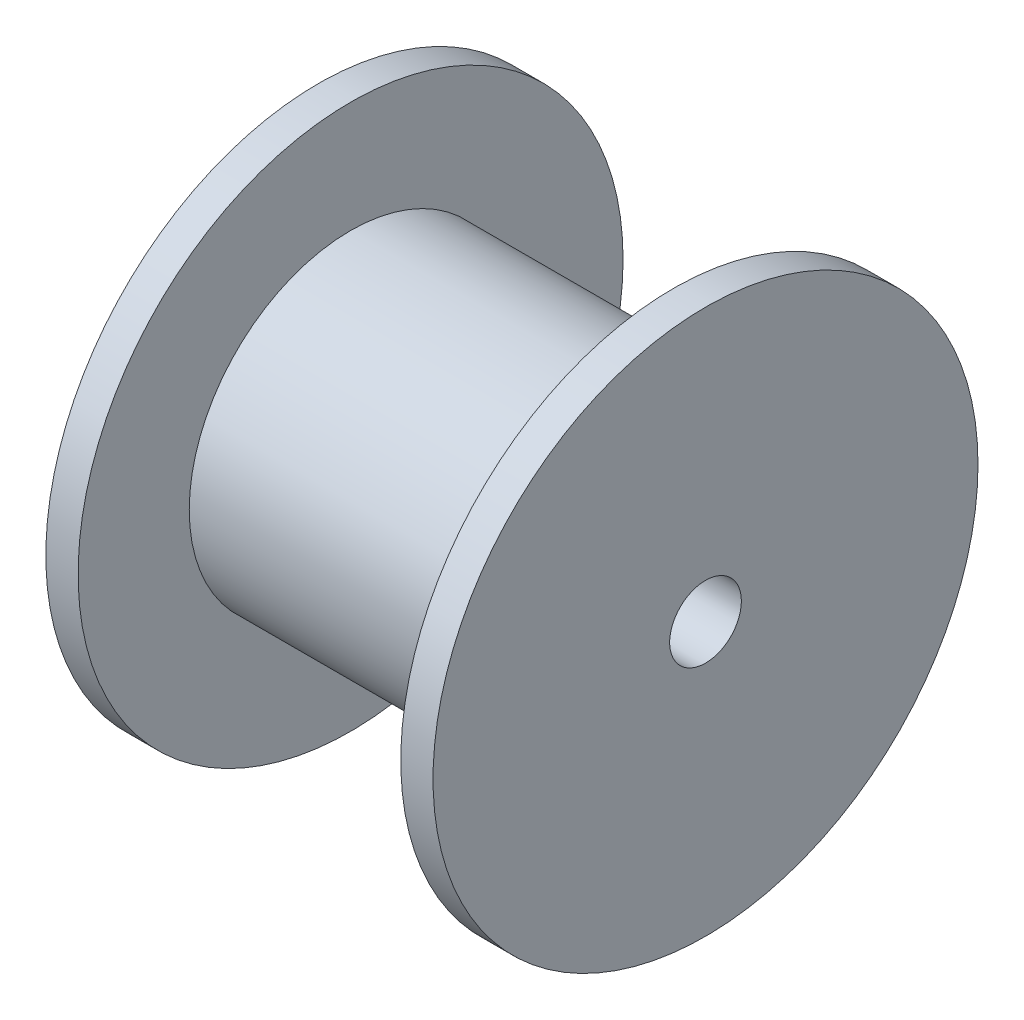
from build123d import *

# Parameters (mm, degrees)
CROQUIS1_R              = 76
SALIENTE_EXTRUIR1_DEPTH = 9
CROQUIS2_R              = 45
SALIENTE_EXTRUIR2_DEPTH = 90
CROQUIS3_R              = 76
SALIENTE_EXTRUIR3_DEPTH = 9
CROQUIS4_R              = 10
CORTAR_EXTRUIR1_DEPTH   = 108


with BuildPart() as part:
    # Croquis1 → Saliente-Extruir1 (new body)
    with BuildSketch(Plane(origin=(0, 0, 0), x_dir=(0, 0, -1), z_dir=(1, 0, 0))):
        Circle(CROQUIS1_R)
    extrude(amount=SALIENTE_EXTRUIR1_DEPTH)

    # Croquis2 → Saliente-Extruir2 (add)
    with BuildSketch(Plane(origin=(9, 0, 0), x_dir=(0, 0, -1), z_dir=(1, 0, 0))):
        Circle(CROQUIS2_R)
    extrude(amount=SALIENTE_EXTRUIR2_DEPTH)

    # Croquis3 → Saliente-Extruir3 (add)
    with BuildSketch(Plane(origin=(99, 0, 0), x_dir=(0, 0, -1), z_dir=(1, 0, 0))):
        Circle(CROQUIS3_R)
    extrude(amount=SALIENTE_EXTRUIR3_DEPTH)

    # Croquis4 → Cortar-Extruir1 (cut)
    with BuildSketch(Plane(origin=(108, 0, 0), x_dir=(0, 0, -1), z_dir=(1, 0, 0))):
        Circle(CROQUIS4_R)
    extrude(amount=-CORTAR_EXTRUIR1_DEPTH, mode=Mode.SUBTRACT)


solid = part.part
